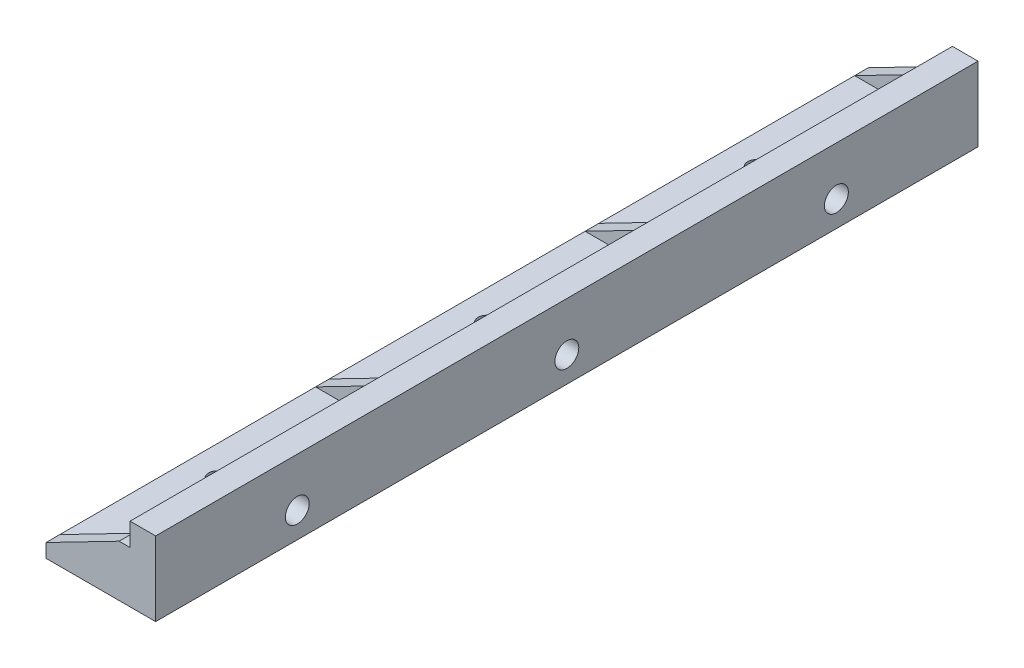
from build123d import *

# Parameters (mm, degrees)
BOSS_EXTRUDE1_DEPTH   = 180
RIB3_REACH            = 124.404
SKETCH4_WALL_W        = 264.810334732
SKETCH4_WALL_H        = 3
RIB4_START            = -3
RIB4_DEPTH            = 3
F_6_CLEARANCE_HOLE1_D = 3.7973
SKETCH6_R             = 2.3495
CUT_EXTRUDE1_DEPTH    = 7
SKETCH12_R            = 2.6162
CUT_EXTRUDE2_DEPTH    = 6.35
SKETCH13_W            = 5.6
SKETCH13_H            = 180
BOSS_EXTRUDE2_DEPTH   = 5


# Read off the part's stored shape, not the designer's step: Rib4
with BuildPart() as part:
    # Sketch1 → Boss-Extrude1 (new body)
    with BuildSketch(Plane.XY):
        with BuildLine():
            Line((0, 0), (0, 11.25))
            Line((0, 11.25), (-8, 11.25))
            Line((-8, 11.25), (-8, 6))
            ThreePointArc((-8, 6), (-8.878679656, 3.878679656), (-11, 3))
            Line((-11, 3), (-24, 3))
            Line((-24, 3), (-24, 0))
            Line((-24, 0), (0, 0))
        make_face()
    extrude(amount=BOSS_EXTRUDE1_DEPTH)

    # Sketch4 wall → Rib3 (add, up to next)
    with BuildSketch(Plane(origin=(-16, 7.125, 60.5), x_dir=(-0.888803167408, -0.458289133195, 0), z_dir=(-0.458289133195, 0.888803167408, 0)), mode=Mode.PRIVATE) as rib3_sk1:
        Rectangle(SKETCH4_WALL_W, SKETCH4_WALL_H)
    rib3_tool1 = extrude(rib3_sk1.sketch, amount=-RIB3_REACH, mode=Mode.PRIVATE) - part.part
    rib3 = rib3_tool1.solids().sort_by_distance((-16, 7.125, 60.5))[0]
    add(rib3)

    # Rib4 outline → Rib4 (add)
    with BuildSketch(Plane(origin=(0, 0, 0), x_dir=(-1, 0, 0), z_dir=(0, 0, -1)).offset(RIB4_START)):
        with BuildLine():
            Line((24, 3), (8, 11.25))
            Line((8, 11.25), (8, 6))
            ThreePointArc((8, 6), (8.878679656, 3.878679656), (11, 3))
            Line((11, 3), (24, 3))
        make_face()
    rib4 = extrude(amount=RIB4_DEPTH)

    # Mirror1: Rib3, Rib4 across plane
    add(rib3.mirror(Plane(origin=(0, 0, 90), x_dir=(1, 0, 0), z_dir=(0, 0, -1))))
    add(rib4.mirror(Plane(origin=(0, 0, 90), x_dir=(1, 0, 0), z_dir=(0, 0, -1))))

    # #6 Clearance Hole1 (through all)
    with Locations(Plane(origin=(0, 0, 0), x_dir=(-1, 0, 0), z_dir=(0, -1, 0))):
        with Locations((17.5, -31), (17.5, -149), (17.5, -90)):
            Hole(F_6_CLEARANCE_HOLE1_D / 2)

    # Sketch6 → Cut-Extrude1 (cut)
    with BuildSketch(Plane(origin=(0, 0, 0), x_dir=(0, 0, -1), z_dir=(1, 0, 0))):
        with Locations((-149, 5.625)):
            Circle(SKETCH6_R)
        with Locations((-31, 5.625)):
            Circle(SKETCH6_R)
        with Locations((-90, 5.625)):
            Circle(SKETCH6_R)
    extrude(amount=-CUT_EXTRUDE1_DEPTH, mode=Mode.SUBTRACT)

    # Sketch12 → Cut-Extrude2 (cut)
    with BuildSketch(Plane(origin=(0, 0, 0), x_dir=(0, 0, -1), z_dir=(1, 0, 0))):
        with Locations((-149, 5.625)):
            Circle(SKETCH12_R)
        with Locations((-31, 5.625)):
            Circle(SKETCH12_R)
        with Locations((-90, 5.625)):
            Circle(SKETCH12_R)
    extrude(amount=-CUT_EXTRUDE2_DEPTH, mode=Mode.SUBTRACT)

    # Sketch13 → Boss-Extrude2 (add)
    with BuildSketch(Plane(origin=(0, 11.25, 0), x_dir=(1, 0, 0), z_dir=(0, 1, 0))):
        with Locations((-2.8, -90)):
            Rectangle(SKETCH13_W, SKETCH13_H)
    extrude(amount=BOSS_EXTRUDE2_DEPTH)


solid = part.part
